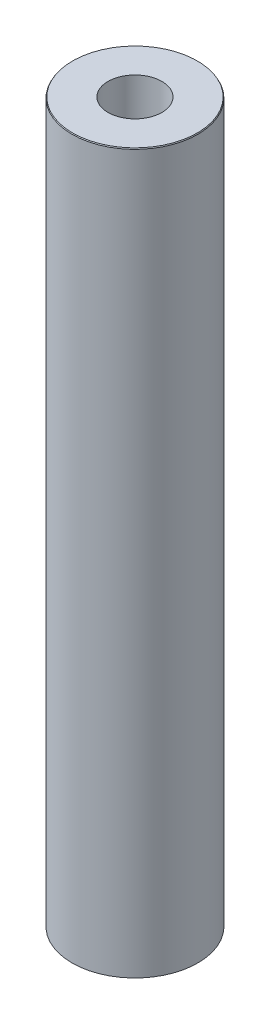
from build123d import *
from OCP.BRepFilletAPI import BRepFilletAPI_MakeChamfer

# Parameters (mm, degrees)
SKETCH1_R           = 52.5
BOSS_EXTRUDE1_DEPTH = 600
SKETCH2_R           = 22.477222422
CUT_EXTRUDE1_DEPTH  = 605.576297914
CHAMFER1_SIZE       = 0.774812971
CHAMFER1_SIZE2      = 0.447338477


with BuildPart() as part:
    # Sketch1 → Boss-Extrude1 (new body)
    with BuildSketch(Plane(origin=(0, 0, 0), x_dir=(1, 0, 0), z_dir=(0, 1, 0))):
        Circle(SKETCH1_R)
    extrude(amount=BOSS_EXTRUDE1_DEPTH)

    # Sketch2 → Cut-Extrude1 (cut, through all)
    with BuildSketch(Plane(origin=(0, 0, 0), x_dir=(1, 0, 0), z_dir=(0, 1, 0))):
        Circle(SKETCH2_R)
    extrude(amount=CUT_EXTRUDE1_DEPTH, mode=Mode.SUBTRACT)

    # Chamfer1: one chamfer whose edges measure the first distance from different faces: ONE call of the kernel's chamfer builder (chamfer() names one face for all edges)
    chamfer1_edges_1 = [part.edges().sort_by_distance(p)[0] for p in [
        (-52.5, 600, 0),
    ]]
    chamfer1_side_1 = [part.faces().sort_by_distance(p)[0] for p in [
        (-52.5, 300, 0),
    ]]
    chamfer1_edges_2 = [part.edges().sort_by_distance(p)[0] for p in [
        (-52.5, 0, 0),
    ]]
    chamfer1_side_2 = [part.faces().sort_by_distance(p)[0] for p in [
        (-51.01507576, 0, 0),
    ]]
    chamfer1 = BRepFilletAPI_MakeChamfer(part.part.solid().wrapped)
    for e in chamfer1_edges_1:
        chamfer1.Add(CHAMFER1_SIZE, CHAMFER1_SIZE2, e.wrapped, chamfer1_side_1[0].wrapped)  # the first distance lies on this face
    for e in chamfer1_edges_2:
        chamfer1.Add(CHAMFER1_SIZE, CHAMFER1_SIZE2, e.wrapped, chamfer1_side_2[0].wrapped)  # the first distance lies on this face
    add(Compound.cast(chamfer1.Shape()), mode=Mode.REPLACE)


solid = part.part
